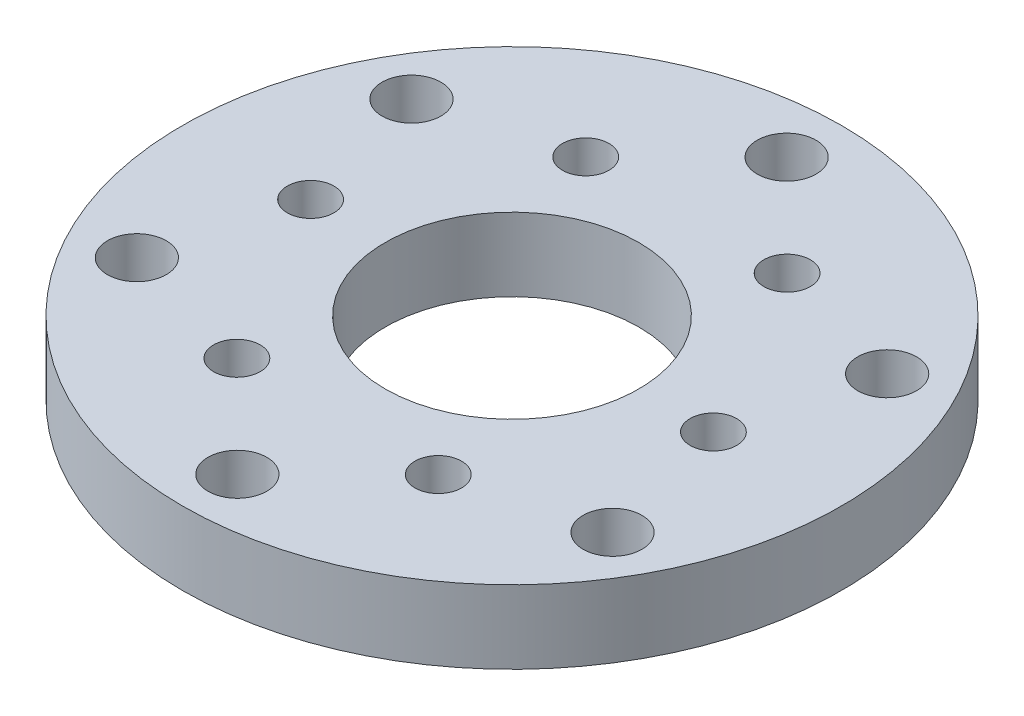
from build123d import *

# Parameters (mm, degrees)
SKETCH1_R               = 28.575
BOSS_EXTRUDE1_DEPTH     = 6.35
F_1_4_20_TAPPED_HOLE1_D = 5.1054
SKETCH5_R               = 11
CUT_EXTRUDE1_DEPTH      = 41.907013457
F_10_32_TAPPED_HOLE1_D  = 4.0386


with BuildPart() as part:
    # Sketch1 → Boss-Extrude1 (new body)
    with BuildSketch(Plane(origin=(0, 0, 0), x_dir=(1, 0, 0), z_dir=(0, 1, 0))):
        Circle(SKETCH1_R)
    extrude(amount=BOSS_EXTRUDE1_DEPTH)

    # 1/4-20 Tapped Hole1 (through all)
    with Locations(Plane(origin=(0, 6.35, 0), x_dir=(1, 0, 0), z_dir=(0, 1, 0))):
        with Locations((0, 23.8125), (20.622229928, 11.90625), (20.622229928, -11.90625), (0, -23.8125), (-20.622229928, -11.90625), (-20.622229928, 11.90625)):
            Hole(F_1_4_20_TAPPED_HOLE1_D / 2)

    # Sketch5 → Cut-Extrude1 (cut, through all)
    with BuildSketch(Plane(origin=(0, 6.35, 0), x_dir=(1, 0, 0), z_dir=(0, 1, 0))):
        Circle(SKETCH5_R)
    extrude(amount=-CUT_EXTRUDE1_DEPTH, mode=Mode.SUBTRACT)

    # #10-32 Tapped Hole1 (through all)
    with Locations(Plane(origin=(0, 6.35, 0), x_dir=(1, 0, 0), z_dir=(0, 1, 0))):
        with Locations((-8.73125, 15.122968614), (8.73125, 15.122968614), (17.4625, 0), (8.73125, -15.122968614), (-8.73125, -15.122968614), (-17.4625, 0)):
            Hole(F_10_32_TAPPED_HOLE1_D / 2)


solid = part.part
